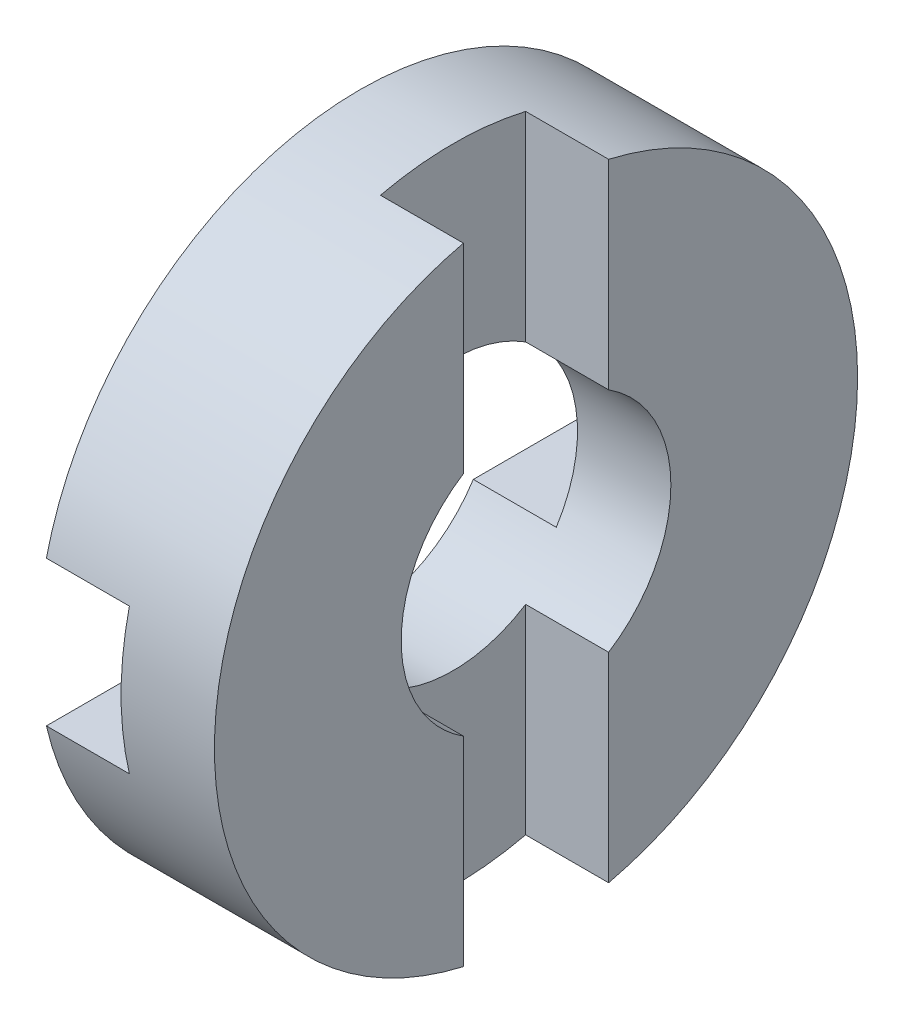
from build123d import *

# Parameters (mm, degrees)
SKETCH1_W          = 8.5
SKETCH1_H          = 9
SKETCH2_W          = 4
SKETCH2_H          = 7
CUT_EXTRUDE1_DEPTH = 15.5
SKETCH3_W          = 4
SKETCH3_H          = 7
CUT_EXTRUDE2_DEPTH = 15.5


with BuildPart() as part:
    # Sketch1 → Revolve1 (revolve)
    with BuildSketch(Plane.XY):
        with Locations((4.25, 11)):
            Rectangle(SKETCH1_W, SKETCH1_H)
    revolve(axis=Axis((0, 0, 0), (1, 0, 0)))

    # Sketch2 → Cut-Extrude1 (cut, symmetric)
    with BuildSketch(Plane.XY):
        with Locations((2, 0)):
            Rectangle(SKETCH2_W, SKETCH2_H)
    extrude(amount=CUT_EXTRUDE1_DEPTH, both=True, mode=Mode.SUBTRACT)

    # Sketch3 → Cut-Extrude2 (cut, symmetric)
    with BuildSketch(Plane(origin=(0, 0, 0), x_dir=(1, 0, 0), z_dir=(0, 1, 0))):
        with Locations((6.5, 0)):
            Rectangle(SKETCH3_W, SKETCH3_H)
    extrude(amount=CUT_EXTRUDE2_DEPTH, both=True, mode=Mode.SUBTRACT)


solid = part.part
